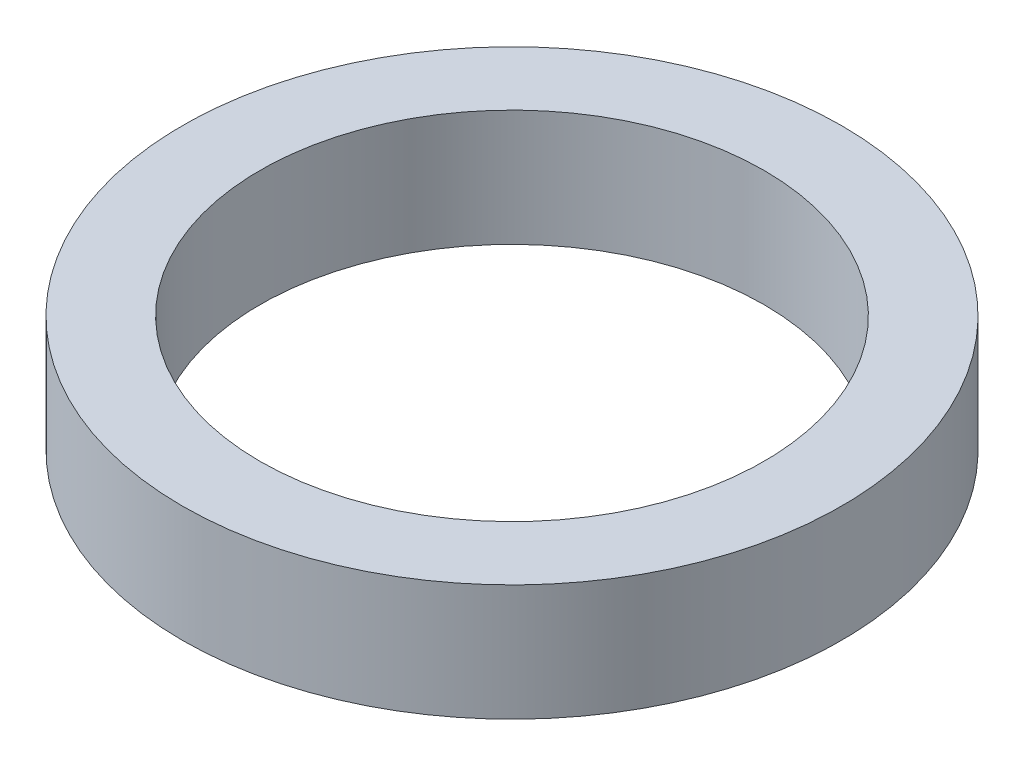
from build123d import *

# Parameters (mm, degrees)
SKETCH1_R           = 42.5
BOSS_EXTRUDE1_DEPTH = 15
SKETCH2_R           = 32.5
CUT_EXTRUDE1_DEPTH  = 62.947558467


with BuildPart() as part:
    # Sketch1 → Boss-Extrude1 (new body)
    with BuildSketch(Plane(origin=(0, 0, 0), x_dir=(1, 0, 0), z_dir=(0, 1, 0))):
        Circle(SKETCH1_R)
    extrude(amount=BOSS_EXTRUDE1_DEPTH)

    # Sketch2 → Cut-Extrude1 (cut, through all)
    with BuildSketch(Plane(origin=(0, 0, 0), x_dir=(1, 0, 0), z_dir=(0, 1, 0))):
        Circle(SKETCH2_R)
    extrude(amount=CUT_EXTRUDE1_DEPTH, mode=Mode.SUBTRACT)


solid = part.part
